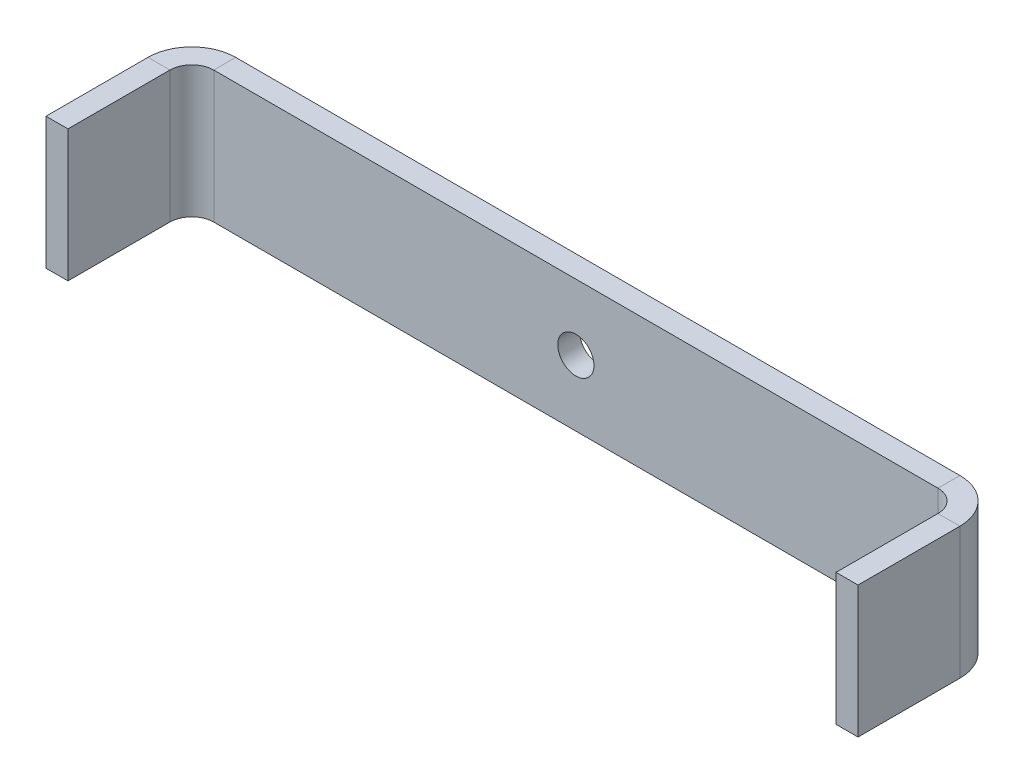
from build123d import *

# Parameters (mm, degrees)
ESBO_O1_W                                      = 94
ESBO_O1_H                                      = 12
FLANGE_BASE1_DEPTH                             = 2
DOBRA_START                                    = -6
DOBRA_ESBO_ADA1_DEPTH                          = 12
DOBRA_ESBO_ADA1_2_DEPTH                        = 12
BROCA_DE_ROSQUEAR_DE_CANO_PARA_TARRAXA_D_D     = 3.3
BROCA_DE_ROSQUEAR_DE_CANO_PARA_TARRAXA_D_DEPTH = 4
BROCA_DE_ROSQUEAR_DE_CANO_PARA_TARRAXA_D_TIP   = 0.991420021


# Read off the part's stored shape, not the designer's step: Dobra esboçada1
# Sheet-metal steps are written as plain solids
with BuildPart() as part:
    # Esboço1 → Flange-base1 (new body)
    with BuildSketch(Plane.XY):
        Rectangle(ESBO_O1_W, ESBO_O1_H)
    extrude(amount=-FLANGE_BASE1_DEPTH)

    # Dobra esboçada1 outline → Dobra esboçada1 (cut)
    with BuildSketch(Plane(origin=(0, 0, 0), x_dir=(1, 0, 0), z_dir=(0, 1, 0)).offset(DOBRA_START)):
        with BuildLine():
            ThreePointArc((-36.464101616, 0), (-35, 1.464101615), (-33, 2))
            Line((-33, 2), (-47, 2))
            Line((-47, 2), (-47, 0))
            Line((-47, 0), (-36.464101616, 0))
        make_face()
        with BuildLine():
            Line((47, 2), (33, 2))
            ThreePointArc((33, 2), (35, 1.464101615), (36.464101616, 0))
            Line((36.464101616, 0), (47, 0))
            Line((47, 0), (47, 2))
        make_face()
    extrude(amount=DOBRA_ESBO_ADA1_DEPTH, mode=Mode.SUBTRACT)

    # Dobra esbo_ada1 2 outline → Dobra esbo_ada1 2 (add)
    with BuildSketch(Plane(origin=(0, 0, 0), x_dir=(1, 0, 0), z_dir=(0, 1, 0)).offset(DOBRA_START)):
        with BuildLine():
            Line((-33, 0), (-36.464101616, 0))
            ThreePointArc((-36.464101616, 0), (-36.863703305, -0.96472382), (-37, -2))
            Line((-37, -2), (-37, -11.28761102))
            Line((-37, -11.28761102), (-35, -11.28761102))
            Line((-35, -11.28761102), (-35, -2))
            ThreePointArc((-35, -2), (-34.414213562, -0.585786438), (-33, 0))
        make_face()
        with BuildLine():
            ThreePointArc((37, -2), (36.863703305, -0.96472382), (36.464101616, 0))
            Line((36.464101616, 0), (33, 0))
            ThreePointArc((33, 0), (34.414213562, -0.585786438), (35, -2))
            Line((35, -2), (35, -11.28761102))
            Line((35, -11.28761102), (37, -11.28761102))
            Line((37, -11.28761102), (37, -2))
        make_face()
    extrude(amount=DOBRA_ESBO_ADA1_2_DEPTH)

    # Broca de rosquear de cano para tarraxa de 1/81
    with Locations(Plane(origin=(0, 0, -2), x_dir=(-1, 0, 0), z_dir=(0, 0, -1))):
        with Locations((0, 0)):
            Hole(BROCA_DE_ROSQUEAR_DE_CANO_PARA_TARRAXA_D_D / 2, depth=BROCA_DE_ROSQUEAR_DE_CANO_PARA_TARRAXA_D_DEPTH)
            with Locations((0, 0, -(BROCA_DE_ROSQUEAR_DE_CANO_PARA_TARRAXA_D_DEPTH + BROCA_DE_ROSQUEAR_DE_CANO_PARA_TARRAXA_D_TIP / 2))):  # 118° drill point
                Cone(0, BROCA_DE_ROSQUEAR_DE_CANO_PARA_TARRAXA_D_D / 2, BROCA_DE_ROSQUEAR_DE_CANO_PARA_TARRAXA_D_TIP, mode=Mode.SUBTRACT)


solid = part.part
